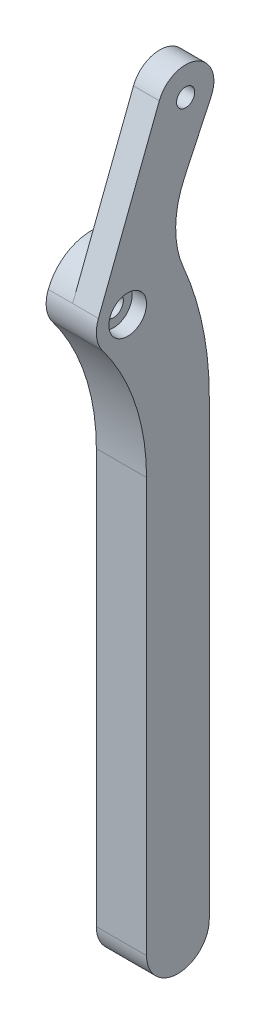
from build123d import *

# Parameters (mm, degrees)
SKETCH1_R           = 1.6
SKETCH1_R_2         = 1.45
BOSS_EXTRUDE1_DEPTH = 4
SKETCH2_R           = 3
CUT_EXTRUDE1_DEPTH  = 2.3
CUT_EXTRUDE2_START  = -0.12
SKETCH1_5_R         = 1.45
CUT_EXTRUDE2_DEPTH  = 96.951003405


with BuildPart() as part:
    # Sketch1 → Boss-Extrude1 (new, symmetric)
    with BuildSketch(Plane(origin=(0, 0, 0), x_dir=(0, 0, -1), z_dir=(1, 0, 0))):
        with BuildLine():
            Line((3, -24), (3, -90))
            ThreePointArc((3, -90), (8, -95), (13, -90))
            Line((13, -90), (13, -17.799320055))
            ThreePointArc((13, -17.799320055), (11.959160872, -7.650400571), (8.879977332, 2.075983213))
            ThreePointArc((8.879977332, 2.075983213), (7.645623758, 8.261271435), (9.063072492, 14.407185379))
            Line((9.063072492, 14.407185379), (13.308813282, 23.461117406))
            ThreePointArc((13.308813282, 23.461117406), (10.999511856, 29.511131641), (5.035153889, 26.988835198))
            Line((5.035153889, 26.988835198), (-4.665988868, 1.79681604))
            ThreePointArc((-4.665988868, 1.79681604), (-4.952494502, -0.687603231), (-4, -3))
            ThreePointArc((-4, -3), (1.203915432, -12.932028189), (3, -24))
        make_face()
        Circle(SKETCH1_R, mode=Mode.SUBTRACT)
        with Locations((9.23454387, 25.371700761)):
            Circle(SKETCH1_R_2, mode=Mode.SUBTRACT)
    extrude(amount=BOSS_EXTRUDE1_DEPTH, both=True)

    # Sketch2 → Cut-Extrude1 (cut)
    with BuildSketch(Plane(origin=(4, 0, 0), x_dir=(0, 0, -1), z_dir=(1, 0, 0))):
        Circle(SKETCH2_R)
    cut_extrude1 = extrude(amount=-CUT_EXTRUDE1_DEPTH, mode=Mode.SUBTRACT)

    # Mirror1: Cut-Extrude1 across plane
    add(cut_extrude1.mirror(Plane(origin=(0, 0, 0), x_dir=(0, 0, 1), z_dir=(1, 0, 0))), mode=Mode.SUBTRACT)

    # Sketch1<5> → Cut-Extrude2 (cut, through all)
    with BuildSketch(Plane(origin=(0, 0, 0), x_dir=(0, 0, -1), z_dir=(1, 0, 0)).offset(CUT_EXTRUDE2_START)):
        with BuildLine():
            ThreePointArc((-4.665988868, 1.79681604), (2.013271717, 6.484076223), (8.879977332, 2.075983213))
            ThreePointArc((8.879977332, 2.075983213), (7.645623758, 8.261271435), (9.063072492, 14.407185379))
            Line((9.063072492, 14.407185379), (13.308813282, 23.461117406))
            ThreePointArc((13.308813282, 23.461117406), (10.999511856, 29.511131641), (5.035153889, 26.988835198))
            Line((5.035153889, 26.988835198), (-4.665988868, 1.79681604))
        make_face()
        with Locations((9.23454387, 25.371700761)):
            Circle(SKETCH1_5_R, mode=Mode.SUBTRACT)
    extrude(amount=-CUT_EXTRUDE2_DEPTH, mode=Mode.SUBTRACT)


solid = part.part
